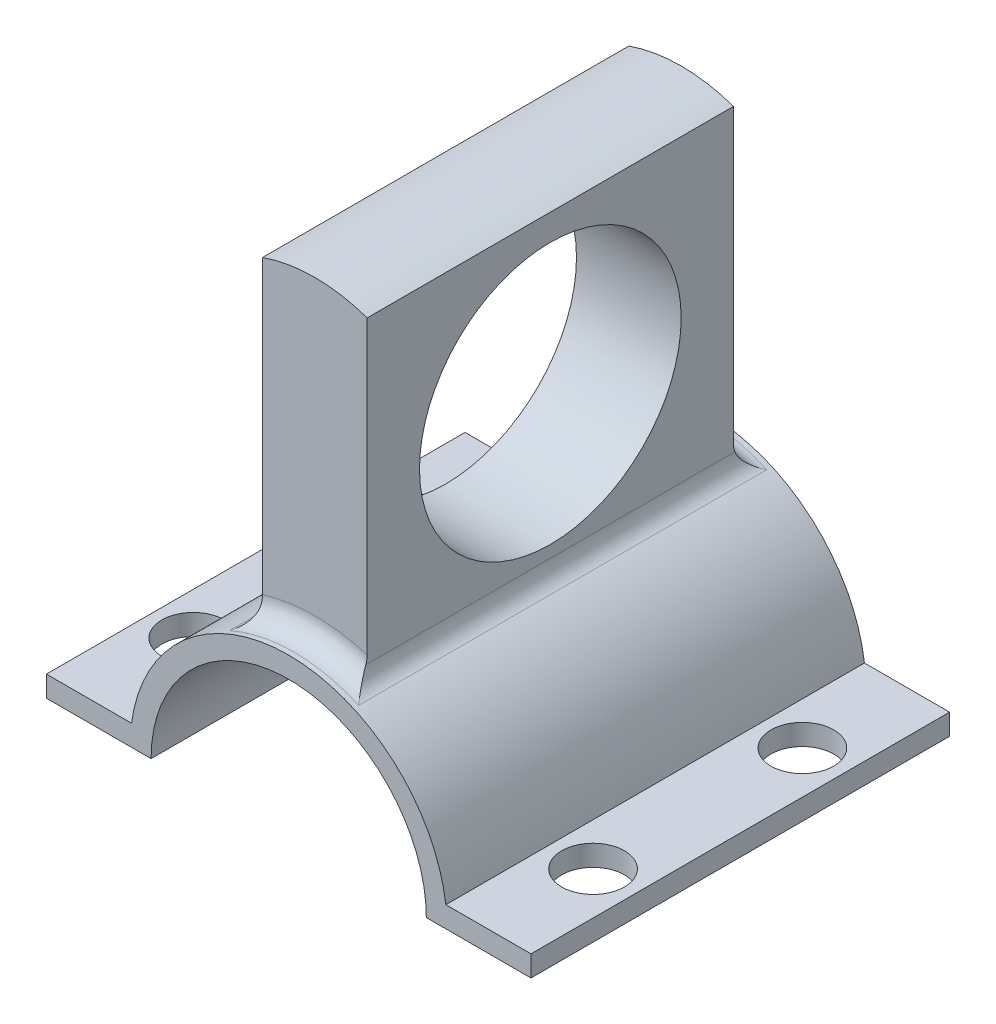
from build123d import *

# Parameters (mm, degrees)
EXTRUDE_THIN1_DEPTH = 25.4
SKETCH2_R           = 3.81
CUT_EXTRUDE1_DEPTH  = 10.922
BOSS_EXTRUDE1_START = -22.225
BOSS_EXTRUDE1_DEPTH = 44.45
SKETCH4_R           = 15.875
CUT_EXTRUDE2_DEPTH  = 38.1
FILLET1_R           = 2.54


# Read off the part's stored shape, not the designer's step: Boss-Extrude1
with BuildPart() as part:
    # Sketch1 → Extrude-Thin1 (new, symmetric)
    with BuildSketch(Plane.XY):
        with BuildLine():
            Line((29.4005, 0), (16.7005, 0))
            ThreePointArc((16.7005, 0), (0, 16.7005), (-16.7005, 0))
            Line((-16.7005, 0), (-29.4005, 0))
            Line((-29.4005, 0), (-29.4005, 2.54))
            Line((-29.4005, 2.54), (-19.07210634, 2.54))
            ThreePointArc((-19.07210634, 2.54), (0, 19.2405), (19.07210634, 2.54))
            Line((19.07210634, 2.54), (29.4005, 2.54))
            Line((29.4005, 2.54), (29.4005, 0))
        make_face()
    extrude(amount=EXTRUDE_THIN1_DEPTH, both=True)

    # Sketch2 → Cut-Extrude1 (cut)
    with BuildSketch(Plane(origin=(0, 2.54, 0), x_dir=(1, 0, 0), z_dir=(0, 1, 0))):
        with Locations(Location((24.23630317, -12.7, 0), (0, 0, 270))):
            Circle(SKETCH2_R)
        with Locations(Location((24.23630317, 12.7, 0), (0, 0, 270))):
            Circle(SKETCH2_R)
        with Locations(Location((-24.27769683, 12.7, 0), (0, 0, 270))):
            Circle(SKETCH2_R)
        with Locations(Location((-24.27769683, -12.7, 0), (0, 0, 270))):
            Circle(SKETCH2_R)
    extrude(amount=-CUT_EXTRUDE1_DEPTH, mode=Mode.SUBTRACT)

    # Boss-Extrude1 outline → Boss-Extrude1 (add)
    with BuildSketch(Plane.XY.offset(BOSS_EXTRUDE1_START)):
        with BuildLine():
            ThreePointArc((6.35, 56.262443124), (0, 57.3405), (-6.35, 56.262443124))
            Line((-6.35, 56.262443124), (-6.35, 18.162443124))
            ThreePointArc((-6.35, 18.162443124), (0, 19.2405), (6.35, 18.162443124))
            Line((6.35, 18.162443124), (6.35, 56.262443124))
        make_face()
    extrude(amount=BOSS_EXTRUDE1_DEPTH)

    # Sketch4 → Cut-Extrude2 (cut)
    with BuildSketch(Plane(origin=(6.35, 0, 0), x_dir=(0, 0, -1), z_dir=(1, 0, 0))):
        with Locations((0, 37.212443124)):
            Circle(SKETCH4_R)
    extrude(amount=-CUT_EXTRUDE2_DEPTH, mode=Mode.SUBTRACT)

    # Fillet1
    fillet1_edges = [part.edges().sort_by_distance(p)[0] for p in [
        (-6.35, 18.162443124, 0),
        (0, 19.2405, 22.225),
        (6.35, 18.162443124, 0),
        (0, 19.2405, -22.225),
    ]]
    fillet(fillet1_edges, radius=FILLET1_R)


solid = part.part
